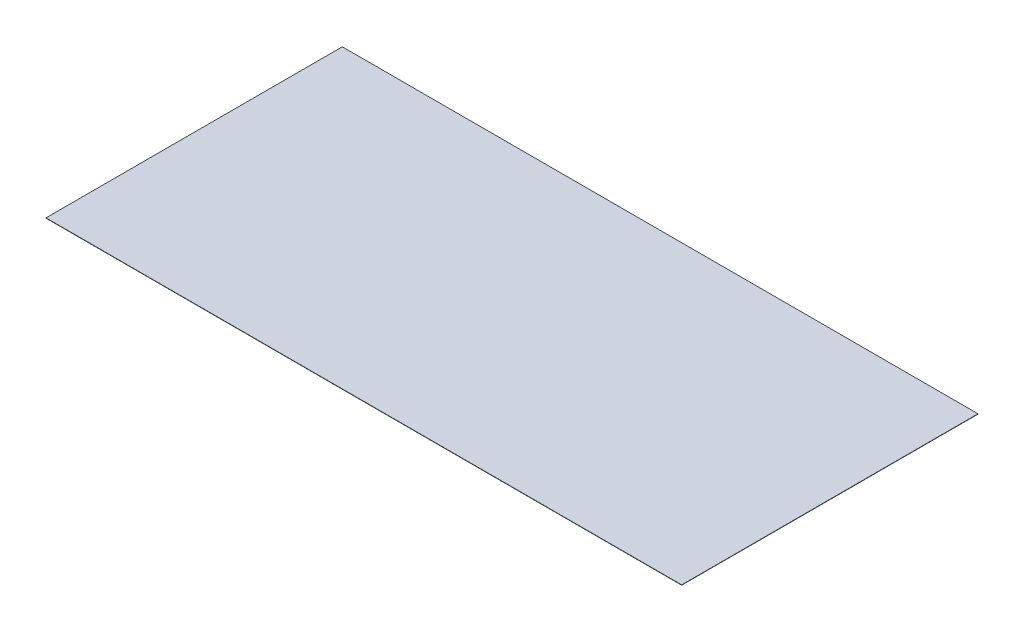
from build123d import *

# Parameters (mm, degrees)
SKETCH1_W           = 817.372
SKETCH1_H           = 381
BOSS_EXTRUDE1_DEPTH = 0.4


with BuildPart() as part:
    # Sketch1 → Boss-Extrude1 (new body)
    with BuildSketch(Plane(origin=(0, 0, 0), x_dir=(1, 0, 0), z_dir=(0, 1, 0))):
        Rectangle(SKETCH1_W, SKETCH1_H)
    extrude(amount=BOSS_EXTRUDE1_DEPTH)


solid = part.part
